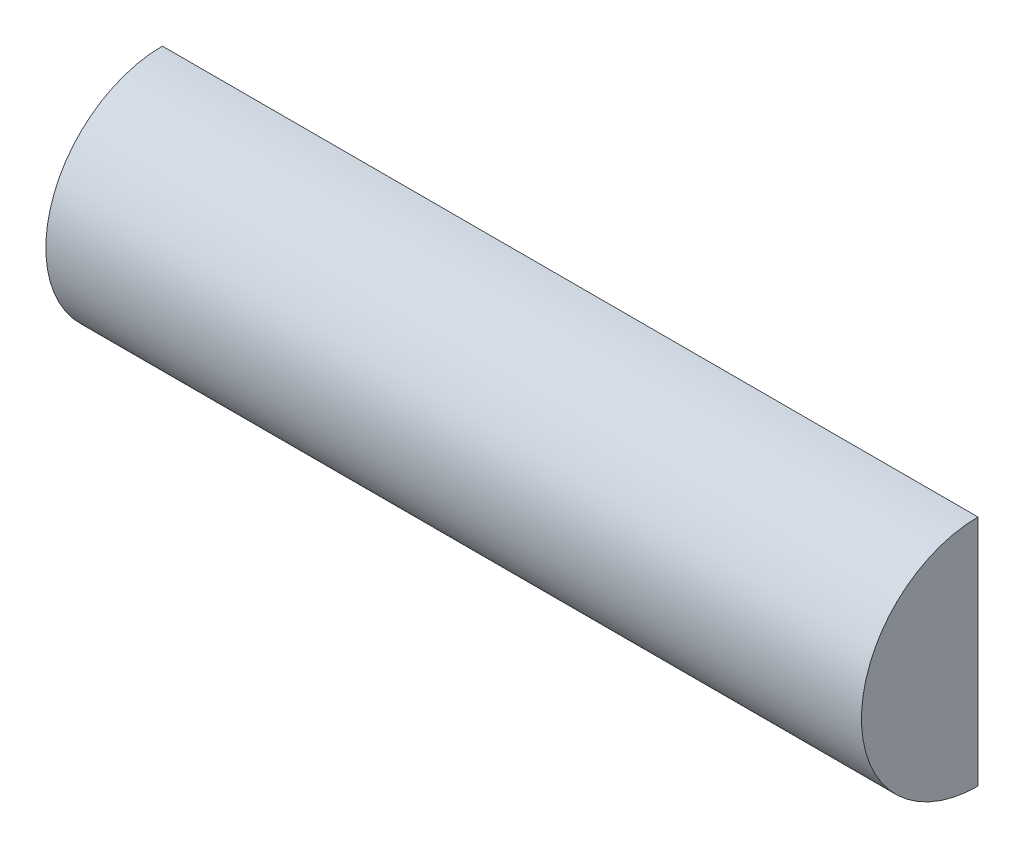
from build123d import *

# Parameters (mm, degrees)
FOREBODY_ANGLE = 180
SKETCH2_W      = 35000
SKETCH2_H      = 5000
FLUID_ANGLE    = 180
BOI_ANGLE      = 180


with BuildPart() as part:
    # Sketch1 → Forebody (revolve)
    with BuildSketch(Plane.XY):
        with BuildLine():
            Line((500, 0), (500, 40))
            Line((500, 40), (-350, 40))
            ThreePointArc((-350, 40), (-427.30823048, 30.482921921), (-500, 2.5))
            ThreePointArc((-500, 2.5), (-501.257357908, 1.455886326), (-502, 0))
            Line((-502, 0), (500, 0))
        make_face()
    revolve(axis=Axis((-668.954225757, 0, 0), (1, 0, 0)), revolution_arc=FOREBODY_ANGLE)


with BuildPart() as body_2:
    # Sketch2 → Fluid (revolve)
    with BuildSketch(Plane.XY):
        with Locations((7500, 2500)):
            Rectangle(SKETCH2_W, SKETCH2_H)
    revolve(axis=Axis((-10000, 0, 0), (1, 0, 0)), revolution_arc=FLUID_ANGLE)

    # Combine1: cut part
    add(part.part, mode=Mode.SUBTRACT)


with BuildPart() as body_2_2:
    # Sketch4 → BOI (revolve)
    with BuildSketch(Plane.XY):
        with BuildLine():
            Line((-622, 0), (3000, 0))
            Line((3000, 0), (3000, 120))
            Line((3000, 120), (-502, 120))
            ThreePointArc((-502, 120), (-586.852813742, 84.852813742), (-622, 0))
        make_face()
    revolve(axis=Axis((-668.954225757, 0, 0), (1, 0, 0)), revolution_arc=BOI_ANGLE)


solid = Compound([body_2.part, body_2_2.part])
